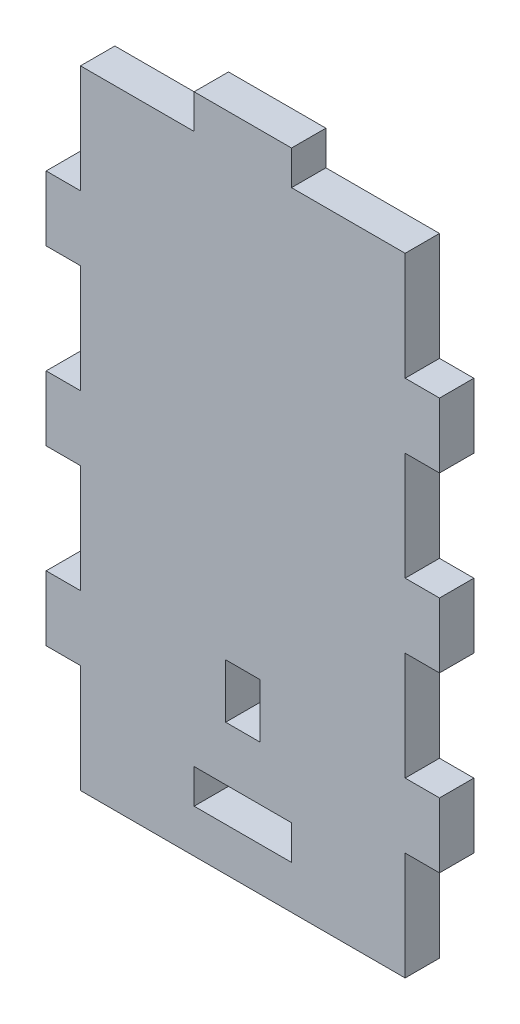
from build123d import *

# Parameters (mm, degrees)
BOSS_EXTRUDE2_DEPTH = 1.5875


with BuildPart() as part:
    # Sketch1 → Boss-Extrude2 (new, symmetric)
    with BuildSketch(Plane.XY):
        Polygon((-15, 0), (0, 0), (0, 10), (3.175, 10), (3.175, 16), (0, 16), (0, 26), (3.175, 26), (3.175, 32), (0, 32), (0, 42), (3.175, 42), (3.175, 48), (0, 48), (0, 58), (-10.5, 58), (-10.5, 61.175), (-19.5, 61.175), (-19.5, 58), (-30, 58), (-30, 48), (-33.175, 48), (-33.175, 42), (-30, 42), (-30, 32), (-33.175, 32), (-33.175, 26), (-30, 26), (-30, 16), (-33.175, 16), (-33.175, 10), (-30, 10), (-30, 0), align=None)
        Polygon((-10.5, 4), (-15, 4), (-19.5, 4), (-19.5, 7.175), (-15, 7.175), (-10.5, 7.175), align=None, mode=Mode.SUBTRACT)
        Polygon((-13.4125, 12.175), (-15, 12.175), (-16.5875, 12.175), (-16.5875, 17.175), (-13.4125, 17.175), align=None, mode=Mode.SUBTRACT)
    extrude(amount=BOSS_EXTRUDE2_DEPTH, both=True)


solid = part.part
